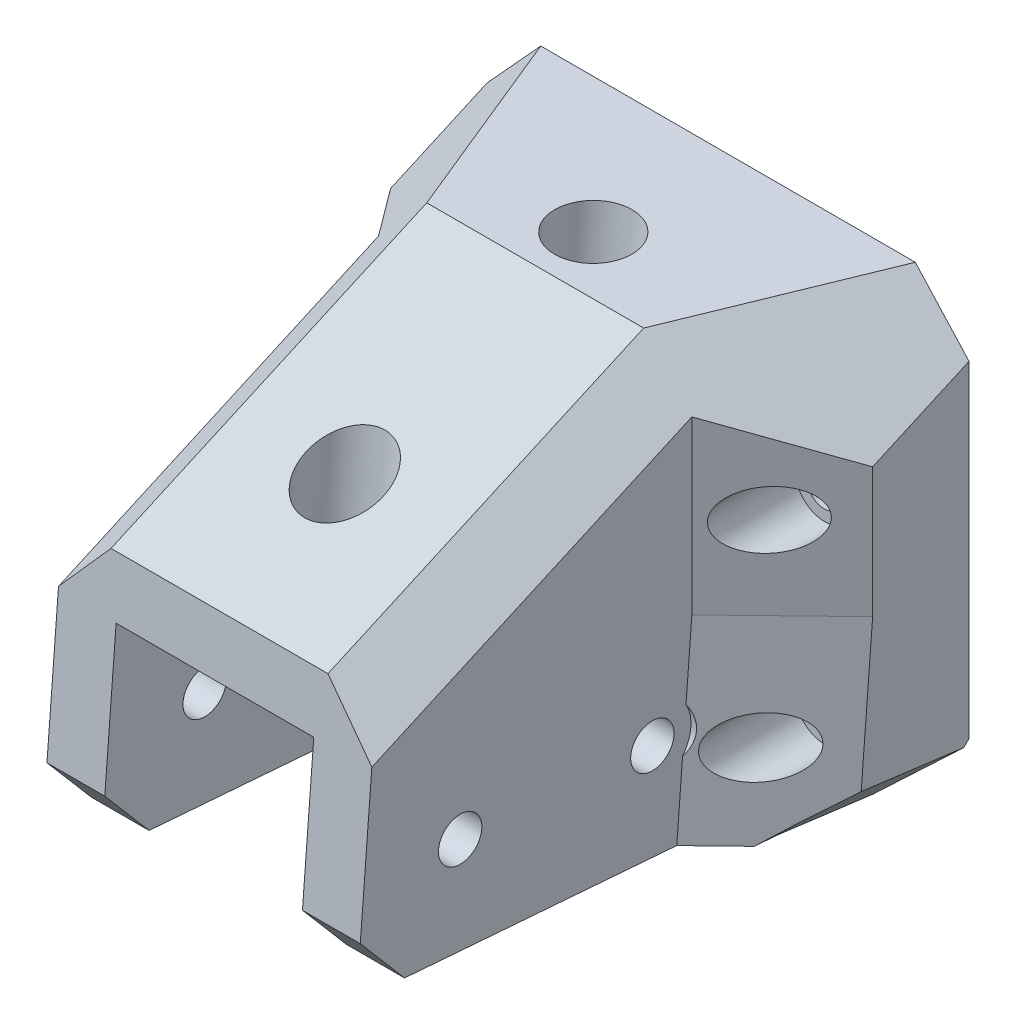
from build123d import *
from OCP.BRepFilletAPI import BRepFilletAPI_MakeChamfer

# Parameters (mm, degrees)
BOSS_EXTRUDE1_DEPTH      = 25
BOSS_EXTRUDE1_DEPTH_BACK = 25
CUT_EXTRUDE1_DEPTH       = 25
BOSS_EXTRUDE3_DEPTH      = 20
CHAMFER2_SIZE            = 10
CHAMFER2_SIZE_2          = 0.5
SKETCH5_R                = 4
CUT_EXTRUDE4_DEPTH       = 20
SKETCH6_R                = 2.25
CUT_EXTRUDE5_DEPTH       = 20
CUT_EXTRUDE6_DEPTH       = 30
CUT_EXTRUDE6_DEPTH_BACK  = 20
SKETCH7_R                = 2.25
SKETCH8_R                = 4
CUT_EXTRUDE7_DEPTH       = 20
CUT_EXTRUDE10_DEPTH      = 10
CUT_EXTRUDE10_DEPTH_BACK = 10
SKETCH10_R               = 1.875
SKETCH10_9_R             = 3
SKETCH10_9_R_2           = 1.875
CUT_EXTRUDE11_DEPTH      = 20
CHAMFER3_START           = -141.531055451
CHAMFER3_DEPTH           = 67.531055451
CHAMFER4_SIZE            = 5
CHAMFER5_START           = 49.569652266
CHAMFER5_DEPTH           = 20.503333196
CHAMFER5_START_2         = -70.072985462
CHAMFER5_2_DEPTH         = 20.503333196


with BuildPart() as part:
    # Sketch1 → Boss-Extrude1 (new, two sides: drawn at the far end of the back side and taken through both)
    with BuildSketch(Plane(origin=(0, 0, 0), x_dir=(0, 0, -1), z_dir=(1, 0, 0)).offset(-BOSS_EXTRUDE1_DEPTH_BACK)):
        Polygon((-106.218311965, -85.648642757), (-56.372445278, -89.571597544), (-57.980856741, -110.008402885), (-53, -105), (-53, -65), (-73, -65), (-105.747557391, -79.667138755), align=None)
    extrude(amount=BOSS_EXTRUDE1_DEPTH + BOSS_EXTRUDE1_DEPTH_BACK)

    # Sketch2 → Cut-Extrude1 (cut)
    with BuildSketch(Plane(origin=(0, -65, 0), x_dir=(1, 0, 0), z_dir=(0, 1, 0))):
        Polygon((16.25, -106.218311965), (16.25, -73), (25, -63), (25, -106.218311965), align=None)
        Polygon((-25, -106.218311965), (-16.25, -106.218311965), (-16.25, -73), (-25, -63), align=None)
    extrude(amount=-CUT_EXTRUDE1_DEPTH, mode=Mode.SUBTRACT)

    # Sketch3 → Boss-Extrude3 (add)
    with BuildSketch(Plane(origin=(0, -93.429506703, 7.353061645), x_dir=(1, 0, 0), z_dir=(0, -0.9969173337331282, 0.07845909572784136))):
        Polygon((10.25, 99.170961297), (10.25, 49.170961297), (25, 49.170961297), (25, 55.819009733), (16.25, 65.849931718), (16.25, 99.170961297), align=None)
        Polygon((-10.25, 99.170961297), (-10.25, 49.170961297), (-25, 49.170961297), (-25, 55.819009733), (-16.25, 65.849931718), (-16.25, 99.170961297), align=None)
    extrude(amount=BOSS_EXTRUDE3_DEPTH)

    # Chamfer2
    chamfer2_edges_1 = [part.edges().sort_by_distance(p)[0] for p in [
        (17.625, -109.509944218, 57.941627193),
    ]]
    chamfer2_side_1 = [part.faces().sort_by_distance(p)[0] for p in [
        (17.625, -109.509159627, 57.951596366),
    ]]
    chamfer2_edges_2 = [part.edges().sort_by_distance(p)[0] for p in [
        (-17.625, -109.509944218, 57.941627193),
    ]]
    chamfer2_side_2 = [part.faces().sort_by_distance(p)[0] for p in [
        (-17.625, -109.509159627, 57.951596366),
    ]]
    chamfer2 = BRepFilletAPI_MakeChamfer(part.part.solid().wrapped)
    for e in chamfer2_edges_1:
        chamfer2.Add(CHAMFER2_SIZE - 0.0001, CHAMFER2_SIZE_2 - 0.0001, e.wrapped, chamfer2_side_1[0].wrapped)
    for e in chamfer2_edges_2:
        chamfer2.Add(CHAMFER2_SIZE - 0.0001, CHAMFER2_SIZE_2 - 0.0001, e.wrapped, chamfer2_side_2[0].wrapped)
    add(Compound.cast(chamfer2.Shape()), mode=Mode.REPLACE)  # a hair under: the kernel refuses the full size

    # Sketch5 → Cut-Extrude4 (cut)
    with BuildSketch(Plane(origin=(0, -87.448002701, 6.882307071), x_dir=(-1, 0, 0), z_dir=(0, -0.9969173337331282, 0.07845909572784136))):
        with Locations(Location((0, -61.670961297, 0), (0, 0, 90))):
            Circle(SKETCH5_R)
        with Locations(Location((0, -86.670961297, 0), (0, 0, 90))):
            Circle(SKETCH5_R)
    extrude(amount=-CUT_EXTRUDE4_DEPTH, mode=Mode.SUBTRACT)

    # Sketch6 → Cut-Extrude5 (cut)
    with BuildSketch(Plane(origin=(0, -87.448002701, 6.882307071), x_dir=(1, 0, 0), z_dir=(0, 0.9969173337331282, -0.07845909572784135))):
        with Locations(Location((0, -61.670961297, 0), (0, 0, 270))):
            Circle(SKETCH6_R)
        with Locations(Location((0, -86.670961297, 0), (0, 0, 270))):
            Circle(SKETCH6_R)
    extrude(amount=-CUT_EXTRUDE5_DEPTH, mode=Mode.SUBTRACT)

    # Sketch7 → Cut-Extrude6 (cut, two sides: drawn at the far end of the back side and taken through both)
    with BuildSketch(Plane(origin=(-10.25, 0, 0), x_dir=(0, 0, -1), z_dir=(1, 0, 0)).offset(-CUT_EXTRUDE6_DEPTH_BACK)):
        with Locations((-97.033729585, -96.402407052)):
            Circle(SKETCH7_R)
        with Locations((-77.09538291, -97.971588966)):
            Circle(SKETCH7_R)
    extrude(amount=CUT_EXTRUDE6_DEPTH + CUT_EXTRUDE6_DEPTH_BACK, mode=Mode.SUBTRACT)

    # Sketch8 → Cut-Extrude7 (cut)
    with BuildSketch(Plane.ZY.offset(16.25)):
        with Locations((77.09538291, -97.971588966)):
            Circle(SKETCH8_R)
    cut_extrude7 = extrude(amount=CUT_EXTRUDE7_DEPTH, mode=Mode.SUBTRACT)

    # Mirror1: Cut-Extrude7 across plane
    add(cut_extrude7.mirror(Plane.ZY), mode=Mode.SUBTRACT)

    # Sketch10 → Cut-Extrude10 (cut, two sides: drawn at the far end of the back side and taken through both)
    with BuildSketch(Plane(origin=(0, 0, 63), x_dir=(-1, 0, 0), z_dir=(0, 0, -1)).offset(-CUT_EXTRUDE10_DEPTH_BACK)):
        with Locations(Location((-20, -100, 0), (0, 0, 356.084777763))):
            Circle(SKETCH10_R)
        with Locations((-20, -80)):
            Circle(SKETCH10_R)
        with Locations(Location((20, -80, 0), (0, 0, 180))):
            Circle(SKETCH10_R)
        with Locations(Location((20, -100, 0), (0, 0, 183.915222237))):
            Circle(SKETCH10_R)
    extrude(amount=CUT_EXTRUDE10_DEPTH + CUT_EXTRUDE10_DEPTH_BACK, mode=Mode.SUBTRACT)

    # Sketch10<9> → Cut-Extrude11 (cut)
    # profile 1 of 4: a face of its own
    with BuildSketch(Plane(origin=(0, 0, 63), x_dir=(-1, 0, 0), z_dir=(0, 0, -1))):
        with Locations((20, -100)):
            Circle(SKETCH10_9_R)
        with Locations((20, -100)):
            Circle(SKETCH10_9_R_2, mode=Mode.SUBTRACT)
    # profile 2 of 4: a face of its own
    with BuildSketch(Plane(origin=(0, 0, 63), x_dir=(-1, 0, 0), z_dir=(0, 0, -1))):
        with Locations((20, -80)):
            Circle(SKETCH10_9_R)
        with Locations((20, -80)):
            Circle(SKETCH10_9_R_2, mode=Mode.SUBTRACT)
    # profile 3 of 4: a face of its own
    with BuildSketch(Plane(origin=(0, 0, 63), x_dir=(-1, 0, 0), z_dir=(0, 0, -1))):
        with Locations((-20, -80)):
            Circle(SKETCH10_9_R)
        with Locations((-20, -80)):
            Circle(SKETCH10_9_R_2, mode=Mode.SUBTRACT)
    # profile 4 of 4: a face of its own
    with BuildSketch(Plane(origin=(0, 0, 63), x_dir=(-1, 0, 0), z_dir=(0, 0, -1))):
        with Locations((-20, -100)):
            Circle(SKETCH10_9_R)
        with Locations((-20, -100)):
            Circle(SKETCH10_9_R_2, mode=Mode.SUBTRACT)
    extrude(amount=-CUT_EXTRUDE11_DEPTH, mode=Mode.SUBTRACT)

    # Chamfer3: read off the stored shape, not the designer's step
    # Chamfer3 outline → Chamfer3 (cut)
    with BuildSketch(Plane(origin=(0, 0, 0), x_dir=(1, 0, 0), z_dir=(0, 0.4087588305450842, -0.9126424373495983)).offset(CHAMFER3_START)):
        Polygon((-25, 43.232363798), (-25, 28), (-9.767636202, 28), align=None)
        Polygon((9.767636202, 28), (25, 28), (25, 43.232363798), align=None)
    extrude(amount=CHAMFER3_DEPTH, mode=Mode.SUBTRACT)

    # Chamfer4
    chamfer4_edges = [part.edges().sort_by_distance(p)[0] for p in [
        (-13.25, -105.586989432, 107.78749388),
        (13.25, -105.586989432, 107.78749388),
    ]]
    chamfer(chamfer4_edges, length=CHAMFER4_SIZE)

    # Chamfer5: read off the stored shape, not the designer's step
    # Chamfer5 outline → Chamfer5 (cut)
    with BuildSketch(Plane(origin=(0, 0, 0), x_dir=(0.7072170856964756, 0.7032116882513418, -0.0730569312637863), z_dir=(0.7069964594670781, -0.7034311334001396, 0.07307972950423045)).offset(CHAMFER5_START)):
        Polygon((-95.809344587, 42.345340215), (-95.562635623, 56.312202838), (-95.604662607, 58.691464219), (-95.627776424, 60), (-100, 60), (-100, 41), (-95.833108513, 41), align=None)
    extrude(amount=CHAMFER5_DEPTH, mode=Mode.SUBTRACT)

    # Chamfer5 2 outline → Chamfer5 2 (cut)
    with BuildSketch(Plane(origin=(0, 0, 0), x_dir=(0.7072170856964753, -0.7032116882513376, 0.0730569312638283), z_dir=(0.7069964594670783, 0.7034311334001349, -0.0730797295042724)).offset(CHAMFER5_START_2)):
        Polygon((95.809344587, -42.345340215), (95.562635623, -56.312202838), (95.604662607, -58.691464219), (95.627776424, -60), (100, -60), (100, -41), (95.833108513, -41), align=None)
    extrude(amount=CHAMFER5_2_DEPTH, mode=Mode.SUBTRACT)


solid = part.part
